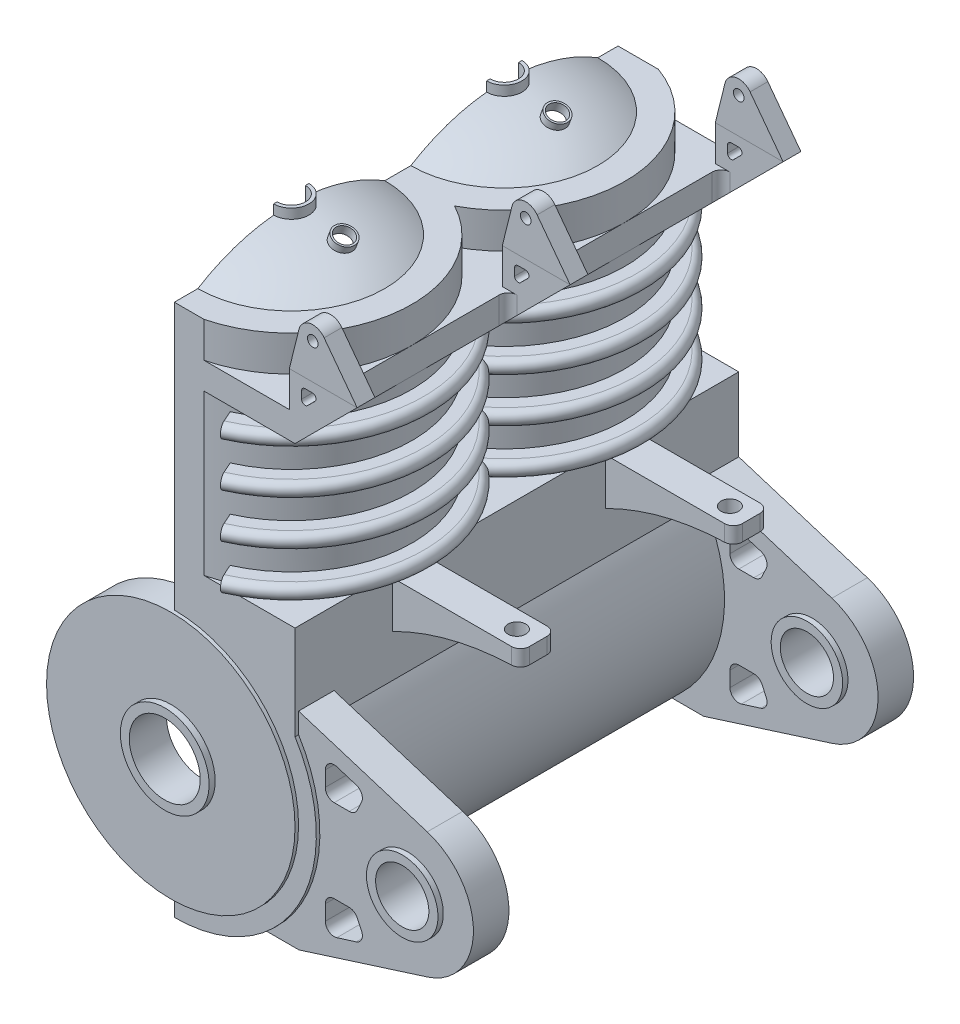
from build123d import *

# Parameters (mm, degrees)
BOSS_EXTRUDE1_DEPTH      = 25
SKETCH2_R                = 5
CUT_EXTRUDE1_DEPTH       = 20
SKETCH3_R                = 7
CUT_EXTRUDE2_DEPTH       = 39.394275615
CUT_EXTRUDE3_DEPTH       = 9
SKETCH5_W                = 0.17
SKETCH5_H                = 0.8
SKETCH5_W_2              = 0.51
SKETCH5_H_2              = 10
REVOLVE1_ANGLE           = 156
LPATTERN1_COUNT          = 2
LPATTERN1_PITCH          = 12
SKETCH6_R                = 5
CUT_EXTRUDE5_DEPTH       = 12
BOSS_EXTRUDE2_START      = -1
SKETCH7_R                = 2.5
BOSS_EXTRUDE2_DEPTH      = 1.5
LPATTERN2_COUNT          = 3
LPATTERN2_PITCH          = 12
BOSS_EXTRUDE3_START      = 0.2
SKETCH8_R                = 2.5
BOSS_EXTRUDE3_DEPTH      = 0.2
BOSS_EXTRUDE4_START      = -1.6
SKETCH9_R                = 2.5
SKETCH9_R_2              = 2
BOSS_EXTRUDE4_DEPTH      = 2.1
LPATTERN4_COUNT          = 3
LPATTERN4_PITCH          = 12.22
BOSS_EXTRUDE5_START      = 2
BOSS_EXTRUDE5_DEPTH      = 2
SKETCH11_R               = 2.015
BOSS_EXTRUDE6_DEPTH      = 2
LPATTERN5_COUNT          = 2
LPATTERN5_PITCH          = 22.8
BOSS_EXTRUDE7_START      = 0.3
SKETCH12_R               = 2.015
SKETCH12_R_2             = 1.5
BOSS_EXTRUDE7_DEPTH      = 2.6
LPATTERN6_COUNT          = 2
LPATTERN6_PITCH          = 22.8
CUT_EXTRUDE6_REACH       = 44.828
REVOLVE2_ANGLE           = 180
LPATTERN7_COUNT          = 2
LPATTERN7_PITCH          = 12
SKETCH15_R               = 0.995
CUT_EXTRUDE7_DEPTH       = 10.3
BOSS_EXTRUDE8_START      = 1.2
BOSS_EXTRUDE8_DEPTH      = 0.8
SKETCH18_W               = 0.32
SKETCH18_H               = 1.5
BOSS_EXTRUDE9_DEPTH      = 1
LPATTERN8_COUNT          = 3
LPATTERN8_PITCH          = 12
FILLET1_R                = 0.5
BOSS_EXTRUDE12_START     = -5.5
BOSS_EXTRUDE12_DEPTH     = 2
LPATTERN9_COUNT          = 2
LPATTERN9_PITCH          = 12
CUT_EXTRUDE10_REACH      = 37.064
CUT_EXTRUDE10_END_RADIUS = 16
SKETCH20_R               = 0.5
FILLET2_R                = 0.5
SKETCH21_W               = 2.846026714
SKETCH21_H               = 2.094310679
CUT_EXTRUDE11_DEPTH      = 45.252800861
SKETCH22_R               = 0.3
BOSS_EXTRUDE13_DEPTH     = 1
LPATTERN10_COUNT         = 3
LPATTERN10_PITCH         = 12
CUT_EXTRUDE19_REACH      = 42.443
CUT_EXTRUDE19_END_RADIUS = 10
SKETCH17_R               = 0.6
CUT_EXTRUDE20_REACH      = 42.443
CUT_EXTRUDE20_END_RADIUS = 10
SKETCH25_R               = 0.6
EXTRUDE_THIN3_START      = 1.9
SKETCH17_9_R             = 0.6
SKETCH17_9_R_2           = 0.5
EXTRUDE_THIN3_DEPTH      = 0.5
EXTRUDE_THIN4_START      = 1.9
SKETCH25_2_R             = 0.6
SKETCH25_2_R_2           = 0.5
EXTRUDE_THIN4_DEPTH      = 0.5


with BuildPart() as part:
    # Sketch1 → Boss-Extrude1 (new body)
    with BuildSketch(Plane.XY):
        with BuildLine():
            Line((0, 0), (0, 28.02))
            Line((0, 28.02), (6.8, 28.02))
            Line((6.8, 28.02), (6.8, 12.214261501))
            ThreePointArc((6.8, 12.214261501), (6.989781542, 4.108605135), (0, 0))
        make_face()
    extrude(amount=BOSS_EXTRUDE1_DEPTH)

    # Sketch2 → Cut-Extrude1 (cut)
    with BuildSketch(Plane(origin=(0, 28.02, 0), x_dir=(1, 0, 0), z_dir=(0, 1, 0))):
        with Locations((0, -6.41)):
            Circle(SKETCH2_R)
        with Locations((0, -18.41)):
            Circle(SKETCH2_R)
    extrude(amount=-CUT_EXTRUDE1_DEPTH, mode=Mode.SUBTRACT)

    # Sketch3 → Cut-Extrude2 (cut, through all)
    with BuildSketch(Plane.XY.offset(25)):
        with Locations((0, 8)):
            Circle(SKETCH3_R)
    extrude(amount=-CUT_EXTRUDE2_DEPTH, mode=Mode.SUBTRACT)

    # Sketch4 → Cut-Extrude3 (cut)
    with BuildSketch(Plane(origin=(0, 26.52, 0), x_dir=(1, 0, 0), z_dir=(0, 1, 0))):
        with BuildLine():
            Line((0, 0.39), (8.758877258, 0.39))
            Line((8.758877258, 0.39), (8.758877258, -25.21))
            Line((8.758877258, -25.21), (0, -25.21))
            ThreePointArc((0, -25.21), (6.596969001, -20.05924225), (3.2, -12.41))
            ThreePointArc((3.2, -12.41), (6.596969001, -4.76075775), (0, 0.39))
        make_face()
    extrude(amount=-CUT_EXTRUDE3_DEPTH, mode=Mode.SUBTRACT)

    # Sketch5 → Revolve1 (revolve)
    with BuildSketch(Plane.ZY):
        with BuildLine():
            Line((0, 25.07), (0, 25.87))
            Line((0, 25.87), (-1.07, 25.87))
            ThreePointArc((-1.07, 25.87), (-1.47, 25.47), (-1.07, 25.07))
            Line((-1.07, 25.07), (0, 25.07))
        make_face()
        with Locations((0.085, 25.47)):
            Rectangle(SKETCH5_W, SKETCH5_H)
        with BuildLine():
            Line((0, 22.57), (0, 23.37))
            Line((0, 23.37), (-1.07, 23.37))
            ThreePointArc((-1.07, 23.37), (-1.47, 22.97), (-1.07, 22.57))
            Line((-1.07, 22.57), (0, 22.57))
        make_face()
        with Locations((0.085, 22.97)):
            Rectangle(SKETCH5_W, SKETCH5_H)
        with BuildLine():
            Line((0, 20.07), (0, 20.87))
            Line((0, 20.87), (-1.07, 20.87))
            ThreePointArc((-1.07, 20.87), (-1.47, 20.47), (-1.07, 20.07))
            Line((-1.07, 20.07), (0, 20.07))
        make_face()
        with Locations((0.085, 20.47)):
            Rectangle(SKETCH5_W, SKETCH5_H)
        with BuildLine():
            Line((-1.07, 17.57), (0, 17.57))
            Line((0, 17.57), (0, 18.37))
            Line((0, 18.37), (-1.07, 18.37))
            ThreePointArc((-1.07, 18.37), (-1.47, 17.97), (-1.07, 17.57))
        make_face()
        with Locations((0.085, 17.97)):
            Rectangle(SKETCH5_W, SKETCH5_H)
        with Locations((0.425, 22.17)):
            Rectangle(SKETCH5_W_2, SKETCH5_H_2)
    revolve1 = revolve(axis=Axis((0, 28.02, 6.41), (0, -1, 0)), revolution_arc=REVOLVE1_ANGLE)

    # LPattern1: Revolve1 ×2
    with Locations(*[(0, 0, i * LPATTERN1_PITCH) for i in range(1, LPATTERN1_COUNT)]):
        add(revolve1)

    # Sketch6 → Cut-Extrude5 (cut)
    with BuildSketch(Plane(origin=(0, 28.02, 0), x_dir=(1, 0, 0), z_dir=(0, 1, 0))):
        with Locations((0, -6.41)):
            Circle(SKETCH6_R)
    extrude(amount=-CUT_EXTRUDE5_DEPTH, mode=Mode.SUBTRACT)

    # Sketch7 → Boss-Extrude2 (add)
    with BuildSketch(Plane(origin=(0, 0, 0), x_dir=(-1, 0, 0), z_dir=(0, 0, -1)).offset(BOSS_EXTRUDE2_START)):
        with BuildLine():
            ThreePointArc((0, 1), (4.949747468, 3.050252532), (7, 8))
            ThreePointArc((7, 8), (4.949747468, 12.949747468), (0, 15))
            ThreePointArc((0, 15), (-7, 8), (0, 1))
        make_face()
        with Locations((0, 8)):
            Circle(SKETCH7_R, mode=Mode.SUBTRACT)
    boss_extrude2 = extrude(amount=BOSS_EXTRUDE2_DEPTH)

    # LPattern2: Boss-Extrude2 ×3
    with Locations(*[(0, 0, i * LPATTERN2_PITCH) for i in range(1, LPATTERN2_COUNT)]):
        add(boss_extrude2)

    # Sketch8 → Boss-Extrude3 (add)
    with BuildSketch(Plane.XY.offset(25).offset(BOSS_EXTRUDE3_START)):
        with BuildLine():
            ThreePointArc((0, 1), (7, 8), (0, 15))
            ThreePointArc((0, 15), (-7, 8), (0, 1))
        make_face()
        with Locations(Location((0, 8, 0), (0, 0, 180))):
            Circle(SKETCH8_R, mode=Mode.SUBTRACT)
    extrude(amount=-BOSS_EXTRUDE3_DEPTH)

    # Sketch9 → Boss-Extrude4 (add)
    with BuildSketch(Plane(origin=(0, 0, -0.5), x_dir=(-1, 0, 0), z_dir=(0, 0, -1)).offset(BOSS_EXTRUDE4_START)):
        with Locations((0, 8)):
            Circle(SKETCH9_R)
        with Locations((0, 8)):
            Circle(SKETCH9_R_2, mode=Mode.SUBTRACT)
    boss_extrude4 = extrude(amount=BOSS_EXTRUDE4_DEPTH)

    # LPattern4: Boss-Extrude4 ×3
    with Locations(*[(0, 0, i * LPATTERN4_PITCH) for i in range(1, LPATTERN4_COUNT)]):
        add(boss_extrude4)

    # Sketch10 → Boss-Extrude5 (add)
    with BuildSketch(Plane(origin=(0, 28.02, 0), x_dir=(1, 0, 0), z_dir=(0, 1, 0)).offset(BOSS_EXTRUDE5_START)):
        with BuildLine():
            Line((0, -25), (0, -23.41))
            ThreePointArc((0, -23.41), (5, -18.41), (0, -13.41))
            Line((0, -13.41), (0, -11.41))
            ThreePointArc((0, -11.41), (5, -6.41), (0, -1.41))
            Line((0, -1.41), (0, 0))
            Line((0, 0), (2.269779725, 0))
            ThreePointArc((2.269779725, 0), (5.553129844, -2.485366395), (6.8, -6.41))
            ThreePointArc((6.8, -6.41), (5.830951895, -9.908571137), (3.2, -12.41))
            ThreePointArc((3.2, -12.41), (5.830951895, -14.911428863), (6.8, -18.41))
            ThreePointArc((6.8, -18.41), (5.368553353, -22.583563813), (1.676872088, -25))
            Line((1.676872088, -25), (0, -25))
        make_face()
    extrude(amount=-BOSS_EXTRUDE5_DEPTH)

    # Sketch11 → Boss-Extrude6 (add)
    with BuildSketch(Plane(origin=(0, 0, 0), x_dir=(-1, 0, 0), z_dir=(0, 0, -1))):
        with BuildLine():
            Line((-6.8, 13.370243), (-14.048629308, 11.100485992))
            ThreePointArc((-14.048629308, 11.100485992), (-16.649992767, 7.567326108), (-14.062603374, 4.023920014))
            Line((-14.062603374, 4.023920014), (-6.822994722, 1.725553141))
            Line((-6.822994722, 1.725553141), (-4.962994722, 1.725553141))
            ThreePointArc((-4.962994722, 1.725553141), (-7.880054694, 6.619877533), (-6.8, 12.214261501))
            Line((-6.8, 12.214261501), (-6.8, 13.370243))
        make_face()
        with Locations((-12.94, 7.56)):
            Circle(SKETCH11_R, mode=Mode.SUBTRACT)
    boss_extrude6 = extrude(amount=-BOSS_EXTRUDE6_DEPTH)

    # LPattern5: Boss-Extrude6 ×2
    with Locations(*[(0, 0, i * LPATTERN5_PITCH) for i in range(1, LPATTERN5_COUNT)]):
        add(boss_extrude6)

    # Sketch12 → Boss-Extrude7 (add)
    with BuildSketch(Plane(origin=(0, 0, 0), x_dir=(-1, 0, 0), z_dir=(0, 0, -1)).offset(BOSS_EXTRUDE7_START)):
        with Locations((-12.94, 7.56)):
            Circle(SKETCH12_R)
        with Locations((-12.94, 7.56)):
            Circle(SKETCH12_R_2, mode=Mode.SUBTRACT)
    boss_extrude7 = extrude(amount=-BOSS_EXTRUDE7_DEPTH)

    # LPattern6: Boss-Extrude7 ×2
    with Locations(*[(0, 0, i * LPATTERN6_PITCH) for i in range(1, LPATTERN6_COUNT)]):
        add(boss_extrude7)

    # Cut-Extrude6: up to this face of the body (flat: up to its plane)
    cut_extrude6_end = Plane(part.part.faces().sort_by_distance((10.833769435, 7.366790097, 24.8))[0])
    # Sketch13 → Cut-Extrude6 (cut, up to the picked face)
    with BuildSketch(Plane(origin=(0, 0, 0), x_dir=(-1, 0, 0), z_dir=(0, 0, -1)), mode=Mode.PRIVATE) as cut_extrude6_sk1:
        with BuildLine():
            Line((-8.305089417, 10.402183251), (-8.305089417, 11.253553125))
            ThreePointArc((-8.305089417, 11.253553125), (-8.509036617, 11.656483317), (-8.954500375, 11.730707572))
            Line((-8.954500375, 11.730707572), (-10.044326053, 11.389451402))
            ThreePointArc((-10.044326053, 11.389451402), (-10.352822104, 11.113098279), (-10.347119102, 10.698962627))
            Line((-10.347119102, 10.698962627), (-10.106464966, 10.188848922))
            ThreePointArc((-10.106464966, 10.188848922), (-9.921966801, 9.979887641), (-9.654260959, 9.902183251))
            Line((-9.654260959, 9.902183251), (-8.805089417, 9.902183251))
            ThreePointArc((-8.805089417, 9.902183251), (-8.451536027, 10.04862986), (-8.305089417, 10.402183251))
        make_face()
    cut_extrude6_tool1 = split(extrude(cut_extrude6_sk1.sketch, amount=-CUT_EXTRUDE6_REACH, mode=Mode.PRIVATE), bisect_by=cut_extrude6_end, keep=Keep.BOTH, mode=Mode.PRIVATE)
    # Sketch13 → Cut-Extrude6 (cut, up to the picked face)
    with BuildSketch(Plane(origin=(0, 0, 0), x_dir=(-1, 0, 0), z_dir=(0, 0, -1)), mode=Mode.PRIVATE) as cut_extrude6_sk2:
        with BuildLine():
            Line((-10.347119102, 4.421037373), (-10.106464966, 4.931151078))
            ThreePointArc((-10.106464966, 4.931151078), (-9.921966801, 5.140112359), (-9.654260959, 5.217816749))
            Line((-9.654260959, 5.217816749), (-8.805089417, 5.217816749))
            ThreePointArc((-8.805089417, 5.217816749), (-8.451536027, 5.07137014), (-8.305089417, 4.717816749))
            Line((-8.305089417, 4.717816749), (-8.305089417, 3.866446875))
            ThreePointArc((-8.305089417, 3.866446875), (-8.509036617, 3.463516683), (-8.954500375, 3.389292428))
            Line((-8.954500375, 3.389292428), (-10.044326053, 3.730548598))
            ThreePointArc((-10.044326053, 3.730548598), (-10.352822104, 4.006901721), (-10.347119102, 4.421037373))
        make_face()
    cut_extrude6_tool2 = split(extrude(cut_extrude6_sk2.sketch, amount=-CUT_EXTRUDE6_REACH, mode=Mode.PRIVATE), bisect_by=cut_extrude6_end, keep=Keep.BOTH, mode=Mode.PRIVATE)
    add(cut_extrude6_tool1.solids().sort_by(Axis((9.255044, 10.780068, 0), (0, 0, 1)))[0], mode=Mode.SUBTRACT)
    add(cut_extrude6_tool2.solids().sort_by(Axis((9.255044, 4.339932, 0), (0, 0, 1)))[0], mode=Mode.SUBTRACT)

    # Sketch14 → Revolve2 (revolve)
    with BuildSketch(Plane.ZY):
        with BuildLine():
            Line((13.142173124, 30.02), (13.373691828, 30.02))
            ThreePointArc((13.373691828, 30.02), (15.799023171, 31.048756477), (18.41, 31.4))
            Line((18.41, 31.4), (18.41, 31.52))
            ThreePointArc((18.41, 31.52), (15.671387212, 31.137692031), (13.142173124, 30.02))
        make_face()
    revolve2 = revolve(axis=Axis((0, 30.02, 18.41), (0, -1, 0)), revolution_arc=REVOLVE2_ANGLE)

    # LPattern7: Revolve2 ×2
    with Locations(*[(0, 0, -i * LPATTERN7_PITCH) for i in range(1, LPATTERN7_COUNT)]):
        add(revolve2)

    # Sketch15 → Cut-Extrude7 (cut)
    with BuildSketch(Plane(origin=(0, 30.02, 0), x_dir=(1, 0, 0), z_dir=(0, 1, 0))):
        with Locations((0, -18.41)):
            Circle(SKETCH15_R)
        with Locations((0, -6.41)):
            Circle(SKETCH15_R)
    extrude(amount=CUT_EXTRUDE7_DEPTH, mode=Mode.SUBTRACT)

    # Sketch16 → Boss-Extrude8 (add)
    with BuildSketch(Plane(origin=(0, 30.02, 0), x_dir=(1, 0, 0), z_dir=(0, 1, 0)).offset(BOSS_EXTRUDE8_START)):
        with BuildLine():
            Line((0, -5.415), (0, -5.61))
            ThreePointArc((0, -5.61), (0.8, -6.41), (0, -7.21))
            Line((0, -7.21), (0, -7.405))
            ThreePointArc((0, -7.405), (0.995, -6.41), (0, -5.415))
        make_face()
        with BuildLine():
            Line((0, -17.61), (0, -17.415))
            ThreePointArc((0, -17.415), (0.995, -18.41), (0, -19.405))
            Line((0, -19.405), (0, -19.21))
            ThreePointArc((0, -19.21), (0.8, -18.41), (0, -17.61))
        make_face()
    extrude(amount=BOSS_EXTRUDE8_DEPTH)

    # Sketch18 → Boss-Extrude9 (add)
    # profile 1 of 2: a face of its own
    with BuildSketch(Plane(origin=(0, 0, 0), x_dir=(-1, 0, 0), z_dir=(0, 0, -1))):
        with BuildLine():
            Line((-10.674299782, 30.394299782), (-6.8, 26.52))
            Line((-6.8, 26.52), (-6.8, 28.02))
            Line((-6.8, 28.02), (-6.48, 28.02))
            Line((-6.48, 28.02), (-6.48, 30.02))
            Line((-6.48, 30.02), (-8.8, 30.02))
            Line((-8.8, 30.02), (-9.924299782, 31.144299782))
            ThreePointArc((-9.924299782, 31.144299782), (-10.674299782, 31.144299782), (-10.674299782, 30.394299782))
        make_face()
        with BuildLine():
            ThreePointArc((-10.511431816, 30.557167748), (-10.511431816, 30.981431816), (-10.087167748, 30.981431816))
            ThreePointArc((-10.087167748, 30.981431816), (-10.022135922, 30.884104812), (-9.999299782, 30.769299782))
            ThreePointArc((-9.999299782, 30.769299782), (-10.184494752, 30.492135922), (-10.511431816, 30.557167748))
        make_face(mode=Mode.SUBTRACT)
        with BuildLine():
            ThreePointArc((-7.923131933, 29.143131933), (-7.966486483, 29.361089975), (-7.781710576, 29.484553289))
            Line((-7.781710576, 29.484553289), (-7.369408209, 29.484553289))
            ThreePointArc((-7.369408209, 29.484553289), (-7.227986853, 29.425974645), (-7.169408209, 29.284553289))
            Line((-7.169408209, 29.284553289), (-7.169408209, 28.872250922))
            ThreePointArc((-7.169408209, 28.872250922), (-7.292871523, 28.687475015), (-7.510829566, 28.730829566))
            Line((-7.510829566, 28.730829566), (-7.923131933, 29.143131933))
        make_face(mode=Mode.SUBTRACT)
    # profile 2 of 2: a face of its own
    with BuildSketch(Plane(origin=(0, 0, 0), x_dir=(-1, 0, 0), z_dir=(0, 0, -1))):
        with Locations((-6.64, 27.27)):
            Rectangle(SKETCH18_W, SKETCH18_H)
    boss_extrude9 = extrude(amount=-BOSS_EXTRUDE9_DEPTH)

    # LPattern8: Boss-Extrude9 ×3
    with Locations(*[(0, 0, i * LPATTERN8_PITCH) for i in range(1, LPATTERN8_COUNT)]):
        add(boss_extrude9)

    # Fillet1
    # the kernel refuses this fillet: 0.5 mm, written as the material it adds along each edge
    with BuildSketch(Plane(origin=(6.8, 25.27, 1), x_dir=(1, 0, 0), z_dir=(0, 1, 0))) as fillet1_piece_1_section:
        with BuildLine():
            CenterArc((FILLET1_R, -FILLET1_R), FILLET1_R, 90, 90)
            Line((0, -FILLET1_R), (0, 0))
            Line((0, 0), (FILLET1_R, 0))
        make_face()
    fillet1_piece_1 = extrude(amount=2.75, mode=Mode.PRIVATE)
    fillet1_piece_1 = split(fillet1_piece_1, bisect_by=Plane(origin=(7.476020806, 27.196020806, 1.005242311), z_dir=(-0.7071067811865485, 0.7071067811865467, 0)), keep=Keep.TOP, mode=Mode.PRIVATE)
    add(fillet1_piece_1)
    with BuildSketch(Plane(origin=(6.8, 25.27, 13), x_dir=(0, 0, 1), z_dir=(0, 1, 0))) as fillet1_piece_2_section:
        with BuildLine():
            CenterArc((FILLET1_R, FILLET1_R), FILLET1_R, 180, 90)
            Line((0, FILLET1_R), (0, 0))
            Line((0, 0), (FILLET1_R, 0))
        make_face()
    fillet1_piece_2 = extrude(amount=2.75, mode=Mode.PRIVATE)
    fillet1_piece_2 = split(fillet1_piece_2, bisect_by=Plane(origin=(7.251531939, 26.971531939, 13.116640472), z_dir=(-0.7071067811865485, 0.7071067811865467, 0)), keep=Keep.TOP, mode=Mode.PRIVATE)
    add(fillet1_piece_2)
    with BuildSketch(Plane(origin=(6.8, 25.27, 12), x_dir=(0, 0, -1), z_dir=(0, 1, 0))) as fillet1_piece_3_section:
        with BuildLine():
            CenterArc((FILLET1_R, -FILLET1_R), FILLET1_R, 90, 90)
            Line((0, -FILLET1_R), (0, 0))
            Line((0, 0), (FILLET1_R, 0))
        make_face()
    fillet1_piece_3 = extrude(amount=2.75, mode=Mode.PRIVATE)
    fillet1_piece_3 = split(fillet1_piece_3, bisect_by=Plane(origin=(7.251531939, 26.971531939, 11.883359528), z_dir=(-0.7071067811865485, 0.7071067811865467, 0)), keep=Keep.TOP, mode=Mode.PRIVATE)
    add(fillet1_piece_3)
    with BuildSketch(Plane(origin=(6.8, 25.27, 24), x_dir=(0, 0, -1), z_dir=(0, 1, 0))) as fillet1_piece_4_section:
        with BuildLine():
            CenterArc((FILLET1_R, -FILLET1_R), FILLET1_R, 90, 90)
            Line((0, -FILLET1_R), (0, 0))
            Line((0, 0), (FILLET1_R, 0))
        make_face()
    fillet1_piece_4 = extrude(amount=2.75, mode=Mode.PRIVATE)
    fillet1_piece_4 = split(fillet1_piece_4, bisect_by=Plane(origin=(7.251531939, 26.971531939, 23.883359528), z_dir=(-0.7071067811865485, 0.7071067811865467, 0)), keep=Keep.TOP, mode=Mode.PRIVATE)
    add(fillet1_piece_4)

    # Sketch19 → Boss-Extrude12 (add)
    with BuildSketch(Plane(origin=(0, 0, 0), x_dir=(-1, 0, 0), z_dir=(0, 0, -1)).offset(BOSS_EXTRUDE12_START)):
        with BuildLine():
            Line((-6.8, 17.218266364), (-14, 17.218266364))
            Line((-14, 17.218266364), (-14, 16.318266364))
            ThreePointArc((-14, 16.318266364), (-10.299683127, 15.884500816), (-6.8, 14.606723243))
            Line((-6.8, 14.606723243), (-6.8, 17.218266364))
        make_face()
    boss_extrude12 = extrude(amount=-BOSS_EXTRUDE12_DEPTH)

    # LPattern9: Boss-Extrude12 ×2
    with Locations(*[(0, 0, i * LPATTERN9_PITCH) for i in range(1, LPATTERN9_COUNT)]):
        add(boss_extrude12)

    # Cut-Extrude10: up to this cylinder (the profile starts outside it)
    cut_extrude10_end = Plane(origin=(14, 0.318266364, 12.5), z_dir=(0, 0, -1)) * Cylinder(CUT_EXTRUDE10_END_RADIUS, 119.128, mode=Mode.PRIVATE)
    # Sketch20 → Cut-Extrude10 (cut, up to the surface)
    with BuildSketch(Plane(origin=(0, 17.218266364, 0), x_dir=(1, 0, 0), z_dir=(0, 1, 0)), mode=Mode.PRIVATE) as cut_extrude10_sk1:
        with Locations(Location((12.8, -18.5, 0), (0, 0, 270))):
            Circle(SKETCH20_R)
    cut_extrude10_tool1 = extrude(cut_extrude10_sk1.sketch, amount=-CUT_EXTRUDE10_REACH, mode=Mode.PRIVATE) - cut_extrude10_end
    add(cut_extrude10_tool1.solids().sort_by_distance((12.8, 17.218266, 18.5))[0], mode=Mode.SUBTRACT)
    # Sketch20 → Cut-Extrude10 (cut, up to the surface)
    with BuildSketch(Plane(origin=(0, 17.218266364, 0), x_dir=(1, 0, 0), z_dir=(0, 1, 0)), mode=Mode.PRIVATE) as cut_extrude10_sk2:
        with Locations(Location((12.8, -6.5, 0), (0, 0, 270))):
            Circle(SKETCH20_R)
    cut_extrude10_tool2 = extrude(cut_extrude10_sk2.sketch, amount=-CUT_EXTRUDE10_REACH, mode=Mode.PRIVATE) - cut_extrude10_end
    add(cut_extrude10_tool2.solids().sort_by_distance((12.8, 17.218266, 6.5))[0], mode=Mode.SUBTRACT)

    # Fillet2
    fillet2_edges = [part.edges().sort_by_distance(p)[0] for p in [
        (14, 16.768266364, 7.5),
        (14, 16.768266364, 5.5),
        (14, 16.768266364, 19.5),
        (14, 16.768266364, 17.5),
    ]]
    fillet(fillet2_edges, radius=FILLET2_R)

    # Sketch21 → Cut-Extrude11 (cut, through all)
    with BuildSketch(Plane(origin=(0, 0, 0), x_dir=(-1, 0, 0), z_dir=(0, 0, -1))):
        with Locations((-9.721047124, 31.06715534)):
            Rectangle(SKETCH21_W, SKETCH21_H)
    extrude(amount=-CUT_EXTRUDE11_DEPTH, mode=Mode.SUBTRACT)

    # Cut-Extrude19: up to this sphere (the profile starts inside it)
    cut_extrude19_end = Location((0, 21.52, 6.41)) * Sphere(CUT_EXTRUDE19_END_RADIUS, mode=Mode.PRIVATE)
    # Sketch17 → Cut-Extrude19 (cut, up to the surface)
    with BuildSketch(Plane(origin=(9.648242021, 26.508327091, 0), x_dir=(0, 0, -1), z_dir=(0.34202014332565694, 0.9396926207859128, -9.515564872434144e-15)), mode=Mode.PRIVATE) as cut_extrude19_sk1:
        with Locations(Location((-6.41, 7.951484989, 0), (0, 0, 49.650778153))):
            Circle(SKETCH17_R)
    cut_extrude19_tool1 = extrude(cut_extrude19_sk1.sketch, amount=CUT_EXTRUDE19_REACH, mode=Mode.PRIVATE) & cut_extrude19_end
    add(cut_extrude19_tool1.solids().sort_by_distance((2.17629, 29.227895, 6.41))[0], mode=Mode.SUBTRACT)

    # Cut-Extrude20: up to this sphere (the profile starts inside it)
    cut_extrude20_end = Location((0, 21.52, 18.41)) * Sphere(CUT_EXTRUDE20_END_RADIUS, mode=Mode.PRIVATE)
    # Sketch25 → Cut-Extrude20 (cut, up to the surface)
    with BuildSketch(Plane(origin=(9.648242021, 26.508327091, 0), x_dir=(0, 0, -1), z_dir=(0.34202014332565694, 0.9396926207859128, -9.515564872434144e-15)), mode=Mode.PRIVATE) as cut_extrude20_sk1:
        with Locations(Location((-18.41, 7.951484989, 0), (0, 0, 49.650778153))):
            Circle(SKETCH25_R)
    cut_extrude20_tool1 = extrude(cut_extrude20_sk1.sketch, amount=CUT_EXTRUDE20_REACH, mode=Mode.PRIVATE) & cut_extrude20_end
    add(cut_extrude20_tool1.solids().sort_by_distance((2.17629, 29.227895, 18.41))[0], mode=Mode.SUBTRACT)

    # Sketch17<9> → Extrude-Thin3 (add)
    with BuildSketch(Plane(origin=(9.648242021, 26.508327091, 0), x_dir=(0, 0, -1), z_dir=(0.34202014332565694, 0.9396926207859128, -9.515564872434144e-15)).offset(EXTRUDE_THIN3_START)):
        with Locations((-6.41, 7.951484989)):
            Circle(SKETCH17_9_R)
        with Locations((-6.41, 7.951484989)):
            Circle(SKETCH17_9_R_2, mode=Mode.SUBTRACT)
    extrude(amount=EXTRUDE_THIN3_DEPTH)

    # Sketch25<2> → Extrude-Thin4 (add)
    with BuildSketch(Plane(origin=(9.648242021, 26.508327091, 0), x_dir=(0, 0, -1), z_dir=(0.34202014332565694, 0.9396926207859128, -9.515564872434144e-15)).offset(EXTRUDE_THIN4_START)):
        with Locations((-18.41, 7.951484989)):
            Circle(SKETCH25_2_R)
        with Locations((-18.41, 7.951484989)):
            Circle(SKETCH25_2_R_2, mode=Mode.SUBTRACT)
    extrude(amount=EXTRUDE_THIN4_DEPTH)


with BuildPart() as body_2:
    # Sketch22 → Boss-Extrude13 (new body)
    with BuildSketch(Plane(origin=(0, 0, 0), x_dir=(-1, 0, 0), z_dir=(0, 0, -1))):
        with BuildLine():
            Line((-6.48, 30.02), (-7.023502573, 32.212488302))
            ThreePointArc((-7.023502573, 32.212488302), (-7.640865997, 32.80401299), (-8.44, 32.5))
            Line((-8.44, 32.5), (-10.3, 30.02))
            Line((-10.3, 30.02), (-6.48, 30.02))
        make_face()
        with Locations((-7.8, 32.02)):
            Circle(SKETCH22_R, mode=Mode.SUBTRACT)
    boss_extrude13 = extrude(amount=-BOSS_EXTRUDE13_DEPTH)


with BuildPart() as lpattern10_1:
    # LPattern10: Boss-Extrude13 ×3
    with Locations(*[(0, 0, i * LPATTERN10_PITCH) for i in range(1, LPATTERN10_COUNT)]):
        add(boss_extrude13)


solid = Compound([part.part, body_2.part, lpattern10_1.part])
